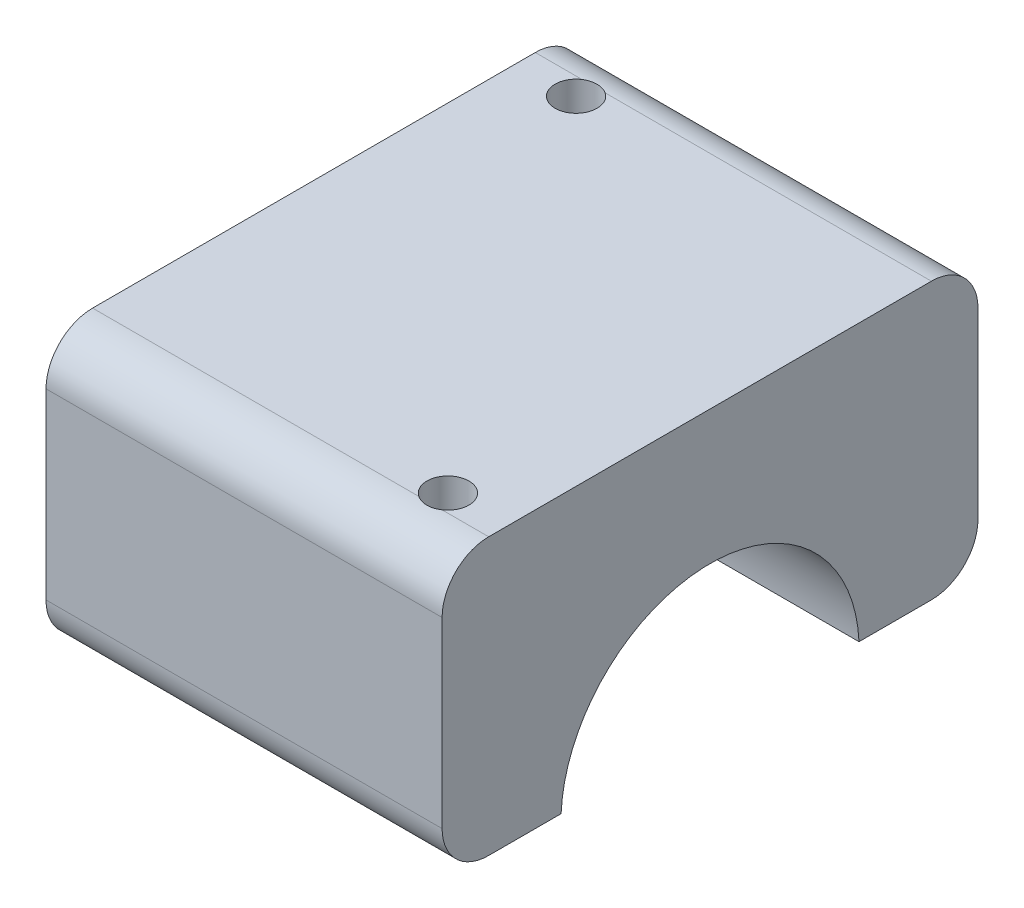
from build123d import *

# Parameters (mm, degrees)
BOSS_EXTRUDE1_DEPTH     = 17
CUT_EXTRUDE1_DEPTH      = 38.525970154
CUT_EXTRUDE1_DEPTH_BACK = 38.525970154
SKETCH2_R               = 12.8
SKETCH3_R               = 1.8
CUT_EXTRUDE2_DEPTH      = 24.294


with BuildPart() as part:
    # Sketch1 → Boss-Extrude1 (new, symmetric)
    with BuildSketch(Plane(origin=(0, 0, 0), x_dir=(0, 0, -1), z_dir=(1, 0, 0))):
        with BuildLine():
            Line((-19, 0.6), (19, 0.6))
            ThreePointArc((19, 0.6), (21.828427125, 1.771572875), (23, 4.6))
            Line((23, 4.6), (23, 20.294))
            ThreePointArc((23, 20.294), (21.828427125, 23.122427125), (19, 24.294))
            Line((19, 24.294), (-19, 24.294))
            ThreePointArc((-19, 24.294), (-21.828427125, 23.122427125), (-23, 20.294))
            Line((-23, 20.294), (-23, 4.6))
            ThreePointArc((-23, 4.6), (-21.828427125, 1.771572875), (-19, 0.6))
        make_face()
    extrude(amount=BOSS_EXTRUDE1_DEPTH, both=True)

    # Sketch2 → Cut-Extrude1 (cut, two sides: drawn at the far end of the back side and taken through both)
    with BuildSketch(Plane(origin=(0, 0, 0), x_dir=(0, 0, -1), z_dir=(1, 0, 0)).offset(-CUT_EXTRUDE1_DEPTH_BACK)):
        Circle(SKETCH2_R)
    extrude(amount=CUT_EXTRUDE1_DEPTH + CUT_EXTRUDE1_DEPTH_BACK, mode=Mode.SUBTRACT)

    # Sketch3 → Cut-Extrude2 (cut)
    with BuildSketch(Plane(origin=(0, 0.6, 0), x_dir=(1, 0, 0), z_dir=(0, 1, 0))):
        with Locations((12, -17.5)):
            Circle(SKETCH3_R)
        with Locations((-12, 17.5)):
            Circle(SKETCH3_R)
    extrude(amount=CUT_EXTRUDE2_DEPTH, mode=Mode.SUBTRACT)


solid = part.part
